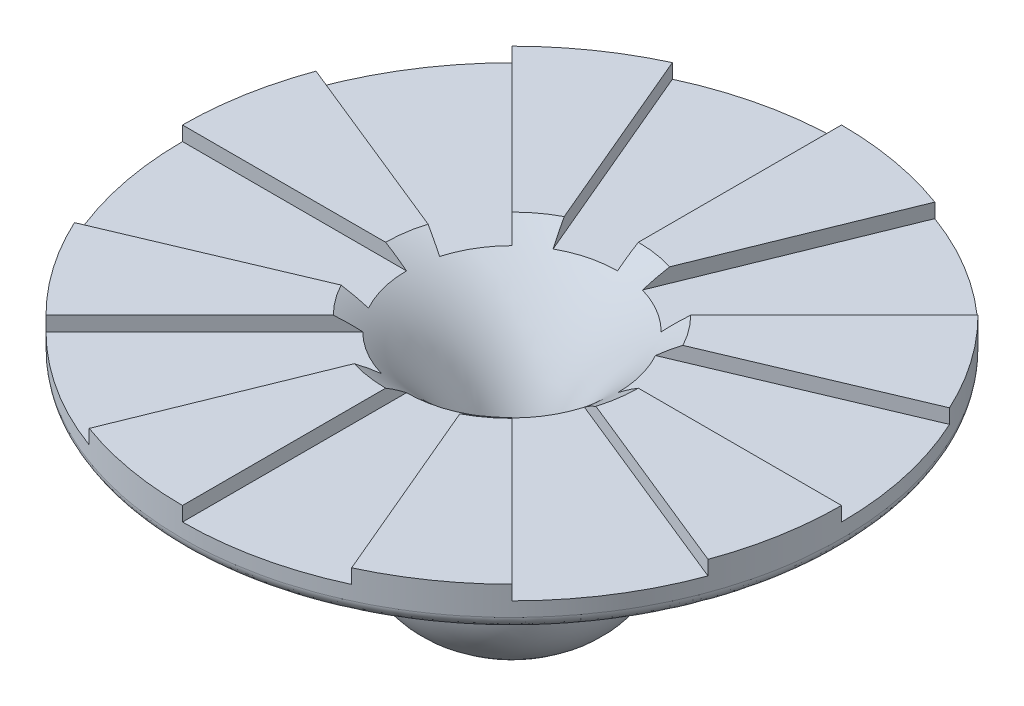
from build123d import *

# Parameters (mm, degrees)
FILLET3_SIZE       = 1
FILLET3_SIZE_2     = 3
CUT_EXTRUDE5_DEPTH = 0.5
CIRPATTERN3_COUNT  = 8


with BuildPart() as part:
    # Sketch2 → Revolve4 (revolve)
    with BuildSketch(Plane.XY, mode=Mode.PRIVATE) as revolve4_sk:
        with BuildLine():
            Line((-10.46, 0), (-10.46, -2))
            Line((-10.46, -2), (-7, -2))
            ThreePointArc((-7, -2), (-4.171572875, -3.171572875), (-3, -6))
            ThreePointArc((-3, -6), (-2.121320344, -8.121320344), (0, -9))
            Line((0, -9), (0, -6))
            ThreePointArc((0, -6), (-0.907428337, -2.553179648), (-3.394448725, 0))
            Line((-3.394448725, 0), (-10.46, 0))
        make_face()
    revolve(revolve4_sk.sketch.rotate(Axis((1, -9, 0), (0, 1, 0)), 270), axis=Axis((1, -9, 0), (0, 1, 0)))

    # Fillet3
    # an asymmetric fillet: 3, 1 mm, written as the material it takes off along each edge
    with BuildSketch(Plane(origin=(1, -2, 0), x_dir=(0, 0, -1), z_dir=(1, 0, 0))) as fillet3_piece_1:
        with BuildLine():
            Bezier((11.46, FILLET3_SIZE), (11.46, 0), (11.46 - FILLET3_SIZE_2, 0), weights=[1, 0.707106781, 1])
            Line((11.46 - FILLET3_SIZE_2, 0), (11.46, 0))
            Line((11.46, 0), (11.46, FILLET3_SIZE))
        make_face()
    revolve(axis=Axis((1, -2, 0), (0, 1, 0)), mode=Mode.SUBTRACT)

    # Sketch8 → Cut-Extrude5 (cut)
    with BuildSketch(Plane(origin=(0, 0, 0), x_dir=(1, 0, 0), z_dir=(0, 1, 0))):
        Polygon((0, 0), (18.255808177, 0), (16.586053461, 7.014284446), align=None)
    cut_extrude5 = extrude(amount=-CUT_EXTRUDE5_DEPTH, mode=Mode.SUBTRACT)

    # CirPattern3: Cut-Extrude5 ×8 about axis
    cirpattern3_axis = Axis((1, 0, 0), (0, 1, 0))
    for i in range(1, CIRPATTERN3_COUNT):
        add(cut_extrude5.rotate(cirpattern3_axis, i * 360 / CIRPATTERN3_COUNT), mode=Mode.SUBTRACT)


solid = part.part
